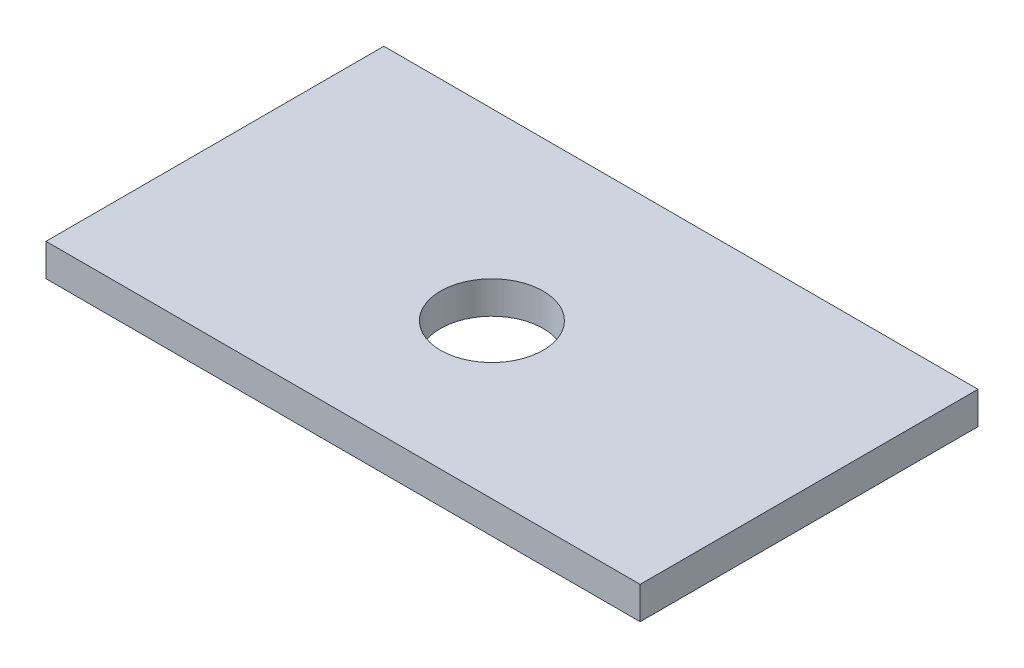
from build123d import *

# Parameters (mm, degrees)
SKETCH1_W           = 110
SKETCH1_H           = 62.55
BOSS_EXTRUDE1_DEPTH = 6
CUT_EXTRUDE1_REACH  = 65.554
SKETCH2_R           = 9.5


with BuildPart() as part:
    # Sketch1 → Boss-Extrude1 (new body)
    with BuildSketch(Plane(origin=(0, 0, 0), x_dir=(1, 0, 0), z_dir=(0, 1, 0))):
        Rectangle(SKETCH1_W, SKETCH1_H)
    extrude(amount=BOSS_EXTRUDE1_DEPTH)

    # Sketch2 → Cut-Extrude1 (cut, up to next)
    with BuildSketch(Plane(origin=(0, 6, 0), x_dir=(1, 0, 0), z_dir=(0, 1, 0)), mode=Mode.PRIVATE) as cut_extrude1_sk1:
        with Locations((-1, -2.725)):
            Circle(SKETCH2_R)
    cut_extrude1_tool1 = extrude(cut_extrude1_sk1.sketch, amount=-CUT_EXTRUDE1_REACH, mode=Mode.PRIVATE) & part.part
    add(cut_extrude1_tool1.solids().sort_by_distance((-1, 6, 2.725))[0], mode=Mode.SUBTRACT)


solid = part.part
